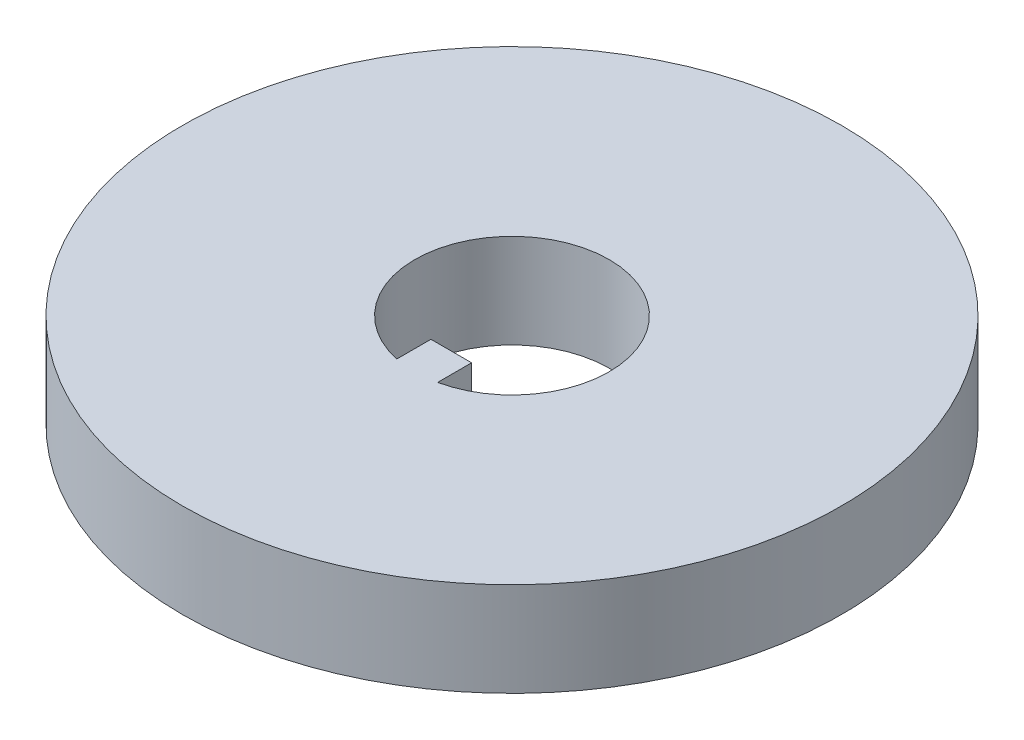
from build123d import *

# Parameters (mm, degrees)
SKETCH1_R           = 52.524640619
BOSS_EXTRUDE1_DEPTH = 15


with BuildPart() as part:
    # Sketch1 → Boss-Extrude1 (new body)
    with BuildSketch(Plane(origin=(0, 0, 0), x_dir=(1, 0, 0), z_dir=(0, 1, 0))):
        Circle(SKETCH1_R)
        with BuildLine():
            Line((3.284699118, -9.722979215), (-3.197287025, -9.722979215))
            Line((-3.197287025, -9.722979215), (-3.197287025, -15.160127177))
            ThreePointArc((-3.197287025, -15.160127177), (-0.044694856, 15.493550359), (3.284699118, -15.141428336))
            Line((3.284699118, -15.141428336), (3.284699118, -9.722979215))
        make_face(mode=Mode.SUBTRACT)
    extrude(amount=BOSS_EXTRUDE1_DEPTH)


solid = part.part
